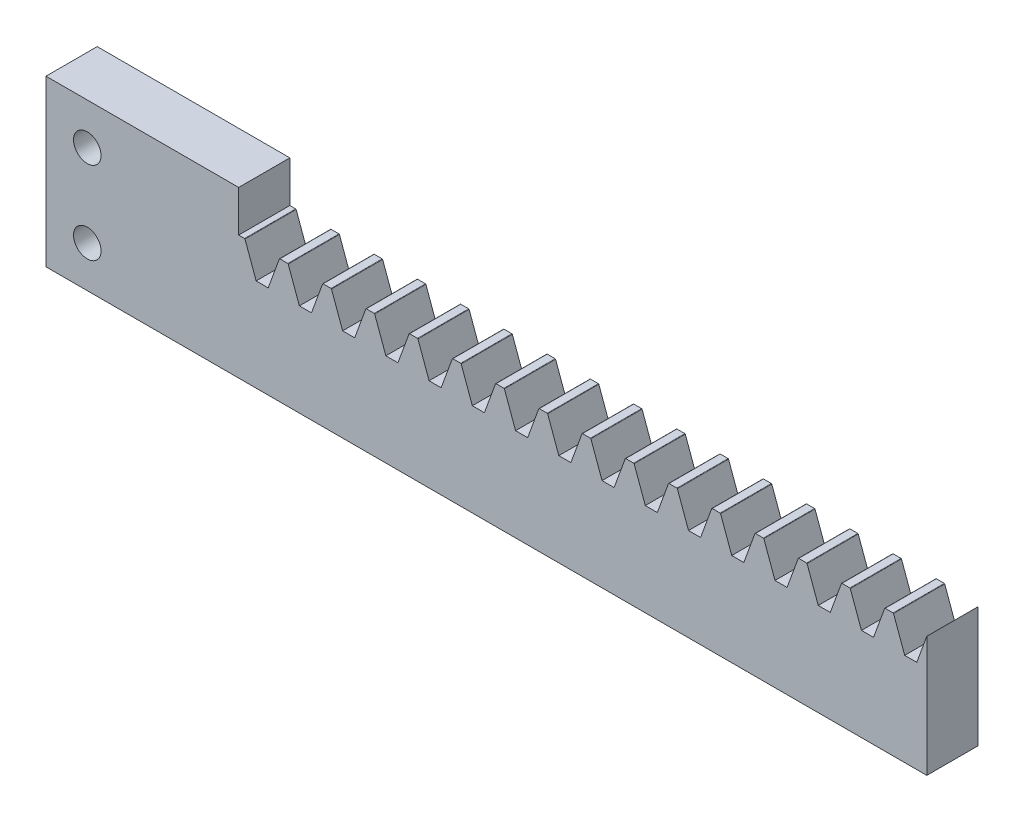
from build123d import *

# Parameters (mm, degrees)
BLANKSKE_W          = 203.2
BLANKSKE_H          = 28.575
BLANK_DEPTH         = 11.811
TOOTHCUTILL_DEPTH   = 206.538975248
TOOTHCUTSIM_DEPTH   = 206.538975248
TEETHCUTS_COUNT     = 22
TEETHCUTS_PITCH     = 9.974556664
SKETCH1_W           = 44.45
SKETCH1_H           = 38.1
BOSS_EXTRUDE1_DEPTH = 11.811
SKETCH2_R           = 3.175
CUT_EXTRUDE1_DEPTH  = 208.07812468


with BuildPart() as part:
    # BlankSke → Blank (new body)
    with BuildSketch(Plane.XY):
        with Locations((101.6, 14.2875)):
            Rectangle(BLANKSKE_W, BLANKSKE_H)
    extrude(amount=-BLANK_DEPTH)

    # TooCutSkeIll → ToothCutIll (cut, through all)
    with BuildSketch(Plane.XY):
        with BuildLine():
            Line((-3.961730054, 28.491436558), (-1.582427729, 21.954357146))
            ThreePointArc((-1.582427729, 21.954357146), (-1.29135804, 21.575027742), (-0.835353302, 21.43125))
            Line((-0.835353302, 21.43125), (0.835353302, 21.43125))
            ThreePointArc((0.835353302, 21.43125), (1.29135804, 21.575027742), (1.582427729, 21.954357146))
            Line((1.582427729, 21.954357146), (3.961730054, 28.491436558))
            ThreePointArc((3.961730054, 28.491436558), (4.00822681, 28.55203231), (4.081071017, 28.575))
            Line((4.081071017, 28.575), (4.081071017, 28.6004))
            Line((4.081071017, 28.6004), (-4.081071017, 28.6004))
            Line((-4.081071017, 28.6004), (-4.081071017, 28.575))
            ThreePointArc((-4.081071017, 28.575), (-4.00822681, 28.55203231), (-3.961730054, 28.491436558))
        make_face()
    toothcutill = extrude(amount=-TOOTHCUTILL_DEPTH, mode=Mode.SUBTRACT)

    # TooCutSkeSim → ToothCutSim (cut, through all)
    with BuildSketch(Plane.XY):
        Polygon((1.392032299, 21.43125), (-1.392032299, 21.43125), (-4.001389504, 28.6004), (4.001389504, 28.6004), align=None)
    toothcutsim = extrude(amount=-TOOTHCUTSIM_DEPTH, mode=Mode.SUBTRACT)

    # TeethCuts: ToothCutIll, ToothCutSim ×22
    with Locations(*[(i * TEETHCUTS_PITCH, 0, 0) for i in range(1, TEETHCUTS_COUNT)]):
        add(toothcutill, mode=Mode.SUBTRACT)
        add(toothcutsim, mode=Mode.SUBTRACT)

    # Sketch1 → Boss-Extrude1 (add)
    with BuildSketch(Plane.XY):
        with Locations((22.225, 19.05)):
            Rectangle(SKETCH1_W, SKETCH1_H)
    extrude(amount=-BOSS_EXTRUDE1_DEPTH)

    # Sketch2 → Cut-Extrude1 (cut, through all)
    with BuildSketch(Plane.XY):
        with Locations((9.525, 28.575)):
            Circle(SKETCH2_R)
        with Locations((9.525, 9.525)):
            Circle(SKETCH2_R)
    extrude(amount=-CUT_EXTRUDE1_DEPTH, mode=Mode.SUBTRACT)


solid = part.part
